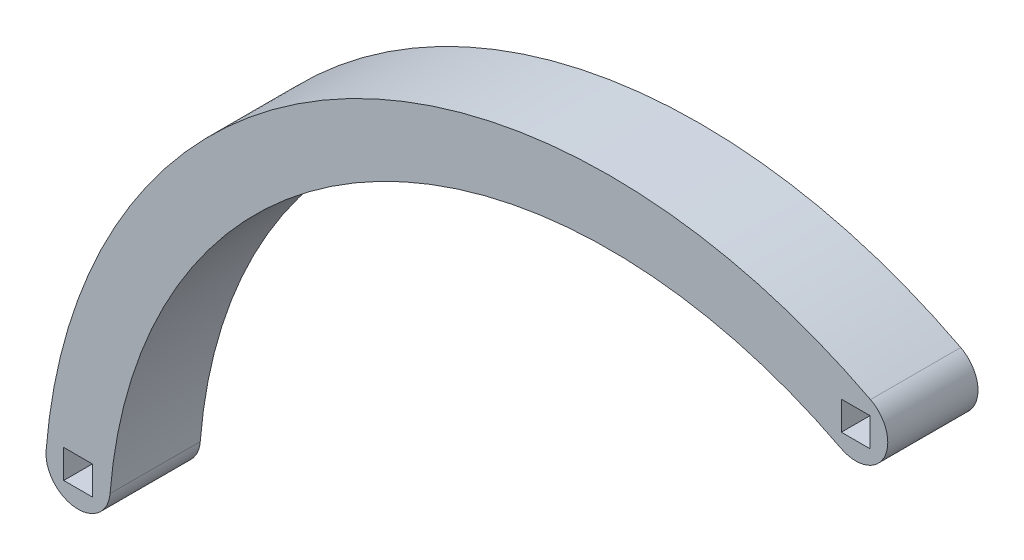
from build123d import *

# Parameters (mm, degrees)
SKETCH1_W           = 3.175
SKETCH1_H           = 3.175
BOSS_EXTRUDE1_DEPTH = 10


with BuildPart() as part:
    # Sketch1 → Boss-Extrude1 (new body)
    with BuildSketch(Plane.XY):
        with BuildLine():
            ThreePointArc((87.832797581, 50.886134002), (28.568839396, 50.099964936), (-3.544586529, 0.284679361))
            ThreePointArc((-3.544586529, 0.284679361), (-0.284679361, -3.544586529), (3.544586529, -0.284679361))
            ThreePointArc((3.544586529, -0.284679361), (32.014208349, 43.87823071), (84.553681435, 44.575195775))
            ThreePointArc((84.553681435, 44.575195775), (89.348708621, 46.091106816), (87.832797581, 50.886134002))
        make_face()
        Rectangle(SKETCH1_W, SKETCH1_H, mode=Mode.SUBTRACT)
        with Locations((86.193239508, 47.730664889)):
            Rectangle(SKETCH1_W, SKETCH1_H, mode=Mode.SUBTRACT)
    extrude(amount=BOSS_EXTRUDE1_DEPTH)


solid = part.part
